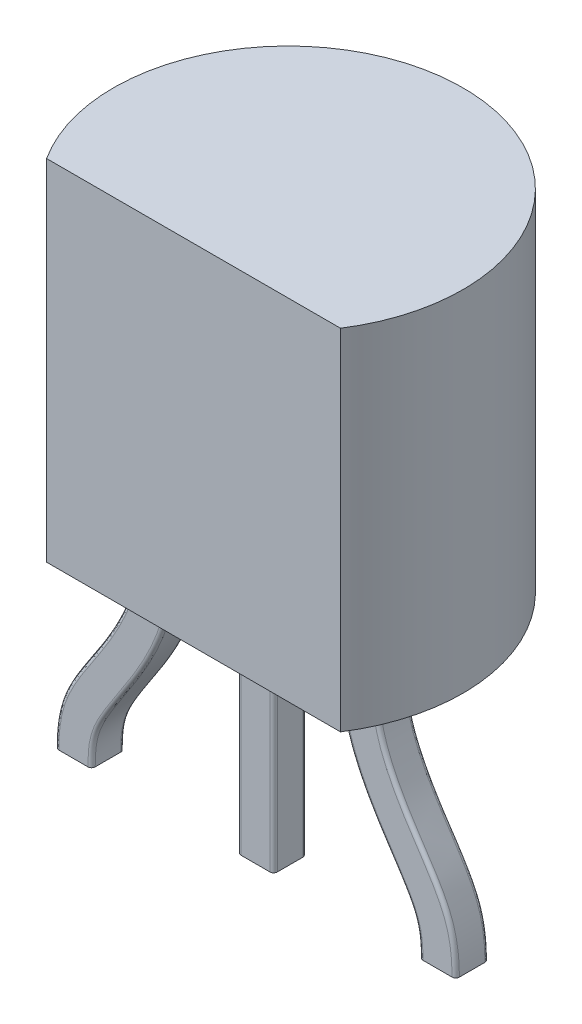
from build123d import *

# Parameters (mm, degrees)
SKETCH_3_W               = 0.5
SKETCH_3_H               = 0.45
EXTRUDE_1_DEPTH          = 3
SWEEP_START              = -0.225
SWEEP_1_DEPTH            = 0.45
PATTERN_CIRCULAR_3_COUNT = 2
EXTRUDE_2_DEPTH          = 4.8
FILLET_1_R               = 0.05


# Read off the part's stored shape, not the designer's step: По траектории1
with BuildPart() as part:
    # Эскиз3 → Бобышка-Вытянуть1 (new body)
    with BuildSketch(Plane(origin=(0, -0.5, 0), x_dir=(1, 0, 0), z_dir=(0, 1, 0))):
        Rectangle(SKETCH_3_W, SKETCH_3_H)
    extrude(amount=EXTRUDE_1_DEPTH)



with BuildPart() as body_2:
    # По траектории1 outline → По траектории1 (new body)
    with BuildSketch(Plane.XY.offset(SWEEP_START)):
        with BuildLine():
            Line((2.25, -0.5), (2.75, -0.5))
            add(Edge.make_bspline(
                [(2.75, -0.5), (2.750000126, -0.281220545), (2.728845558, -0.024058709), (2.498371588, 0.495349612), (2.323275634, 0.734570584), (1.986508629, 1.255041682), (1.828605061, 1.542515407), (1.656766629, 2.071852381), (1.639999849, 2.343781454), (1.64, 2.5)],
                knots=[0, 0, 0, 0, 0.25, 0.25, 0.5, 0.5, 0.75, 0.75, 1, 1, 1, 1], degree=3))
            Line((1.64, 2.5), (1.14, 2.5))
            add(Edge.make_bspline(
                [(2.25, -0.5), (2.250000087, -0.300674936), (2.236454921, -0.147152835), (2.076718558, 0.212827938), (1.913590263, 0.447335392), (1.556625474, 0.999023076), (1.376307663, 1.316441985), (1.157930022, 1.989147397), (1.139999834, 2.31309086), (1.14, 2.5)],
                knots=[0, 0, 0, 0, 0.25, 0.25, 0.5, 0.5, 0.75, 0.75, 1, 1, 1, 1], degree=3))
        make_face()
    extrude(amount=SWEEP_1_DEPTH)


with BuildPart() as pattern_circular_3_1:
    # Круговой массив3: pattern copy
    add(body_2.part.rotate(Axis((0, 0, 0), (0, 1, 0)), 1 * 360 / PATTERN_CIRCULAR_3_COUNT))


with BuildPart() as part_1:
    add(part.part)

    add(body_2.part)  # Бобышка-Вытянуть2 merges body 2

    add(pattern_circular_3_1.part)  # Бобышка-Вытянуть2 merges Круговой массив3_1
    # Эскиз5 → Бобышка-Вытянуть2 (add)
    with BuildSketch(Plane(origin=(0, 2.5, 0), x_dir=(1, 0, 0), z_dir=(0, 1, 0))):
        with BuildLine():
            Line((-2.0174241, -1.075), (2.0174241, -1.075))
            ThreePointArc((2.0174241, -1.075), (0, 2.625), (-2.0174241, -1.075))
        make_face()
    extrude(amount=EXTRUDE_2_DEPTH)

    # Скругление1
    fillet_1_edges = [part_1.edges().sort_by_distance(p)[0] for p in [
        (2.16180874, 0.984133828, -0.225),
        (1.590827674, 0.956527604, -0.225),
        (1.590827674, 0.956527604, 0.225),
        (2.16180874, 0.984133828, 0.225),
        (-2.16180874, 0.984133828, 0.225),
        (-1.590827674, 0.956527604, 0.225),
        (-1.590827674, 0.956527604, -0.225),
        (-2.16180874, 0.984133828, -0.225),
        (-0.25, 1, -0.225),
        (0.25, 1, -0.225),
        (0.25, 1, 0.225),
        (-0.25, 1, 0.225),
    ]]
    fillet(fillet_1_edges, radius=FILLET_1_R)


solid = part_1.part
